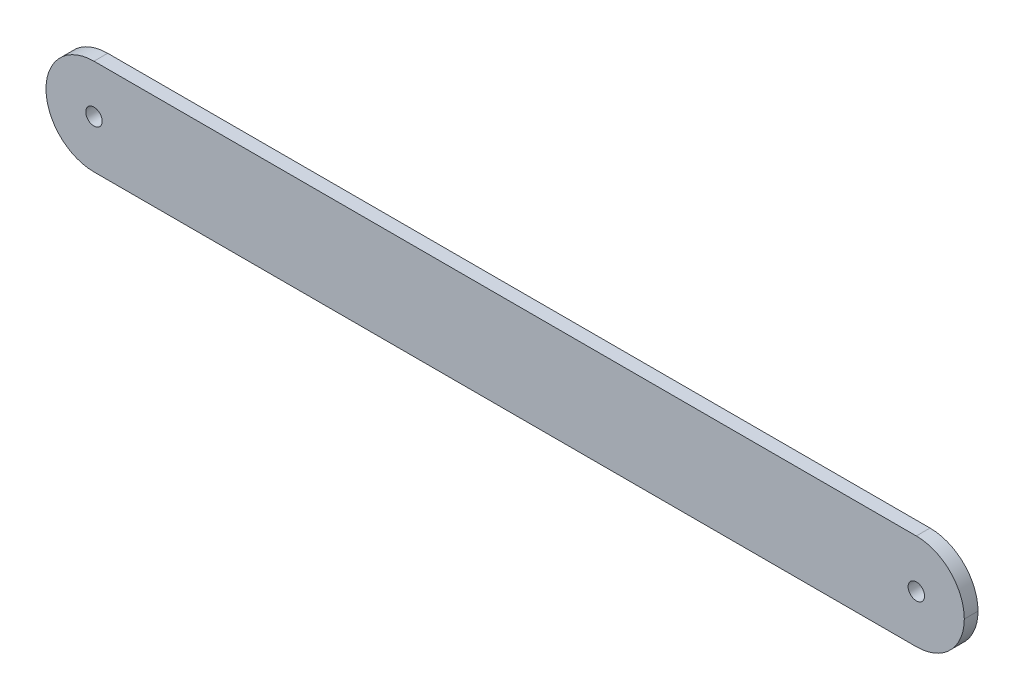
from build123d import *

# Parameters (mm, degrees)
SKETCH1_W           = 670
SKETCH1_H           = 70
BOSS_EXTRUDE1_DEPTH = 10
SKETCH2_R           = 6
CUT_EXTRUDE1_DEPTH  = 337.97180891
FILLET1_R           = 35


with BuildPart() as part:
    # Sketch1 → Boss-Extrude1 (new body)
    with BuildSketch(Plane.XY):
        Rectangle(SKETCH1_W, SKETCH1_H)
    extrude(amount=BOSS_EXTRUDE1_DEPTH)

    # Sketch2 → Cut-Extrude1 (cut, through all)
    with BuildSketch(Plane.XY.offset(10)):
        with Locations((-300, 0)):
            Circle(SKETCH2_R)
        with Locations((300, 0)):
            Circle(SKETCH2_R)
    extrude(amount=-CUT_EXTRUDE1_DEPTH, mode=Mode.SUBTRACT)

    # Fillet1
    fillet1_edges = [part.edges().sort_by_distance(p)[0] for p in [
        (335, -35, 5),
        (335, 35, 5),
        (-335, -35, 5),
        (-335, 35, 5),
    ]]
    fillet(fillet1_edges, radius=FILLET1_R - 0.0001)  # a hair under: the kernel refuses the full size


solid = part.part
